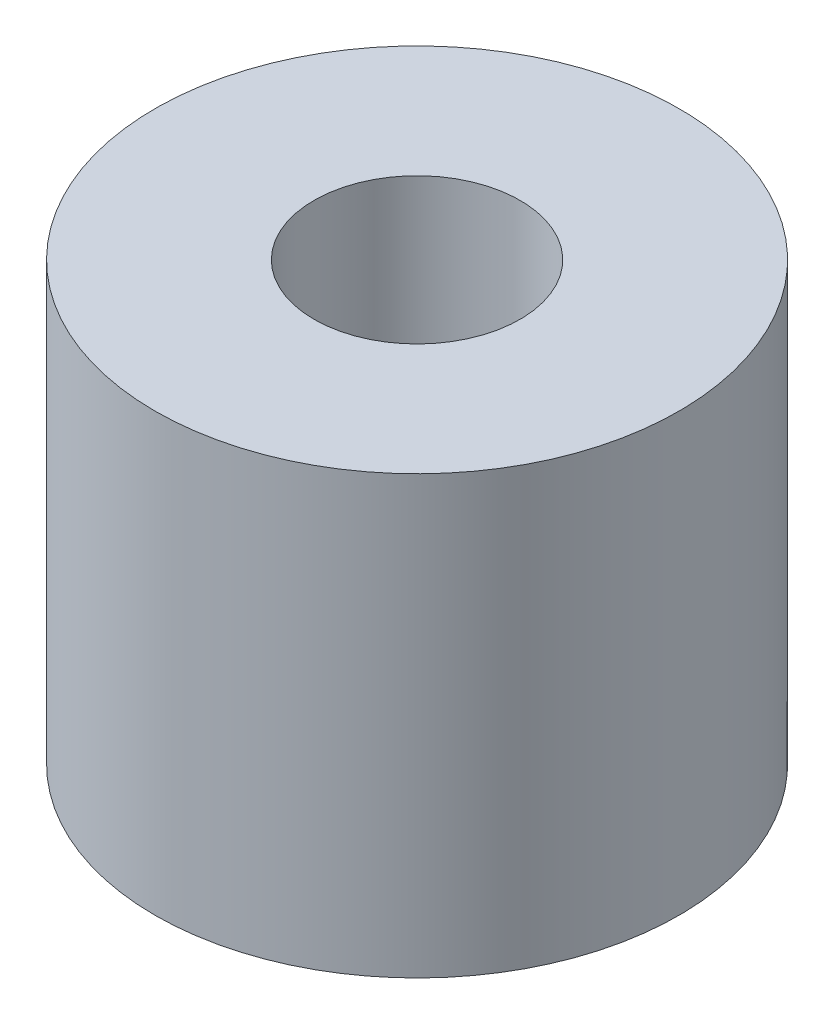
from build123d import *

# Parameters (mm, degrees)
SKETCH1_R               = 15
SKETCH1_R_2             = 2.5
BOSS_EXTRUDE1_DEPTH     = 25
G1_4_TAPPED_HOLE1_D     = 11.8
G1_4_TAPPED_HOLE1_DEPTH = 15
G1_4_TAPPED_HOLE1_TIP   = 3.545077652


with BuildPart() as part:
    # Sketch1 → Boss-Extrude1 (new body)
    with BuildSketch(Plane(origin=(0, 0, 0), x_dir=(1, 0, 0), z_dir=(0, 1, 0))):
        Circle(SKETCH1_R)
        Circle(SKETCH1_R_2, mode=Mode.SUBTRACT)
    extrude(amount=BOSS_EXTRUDE1_DEPTH)

    # G1/4 Tapped Hole1
    with Locations(Plane(origin=(0, 25, 0), x_dir=(1, 0, 0), z_dir=(0, 1, 0))):
        with Locations((0, 0)):
            Hole(G1_4_TAPPED_HOLE1_D / 2, depth=G1_4_TAPPED_HOLE1_DEPTH)
            with Locations((0, 0, -(G1_4_TAPPED_HOLE1_DEPTH + G1_4_TAPPED_HOLE1_TIP / 2))):  # 118° drill point
                Cone(0, G1_4_TAPPED_HOLE1_D / 2, G1_4_TAPPED_HOLE1_TIP, mode=Mode.SUBTRACT)


solid = part.part
